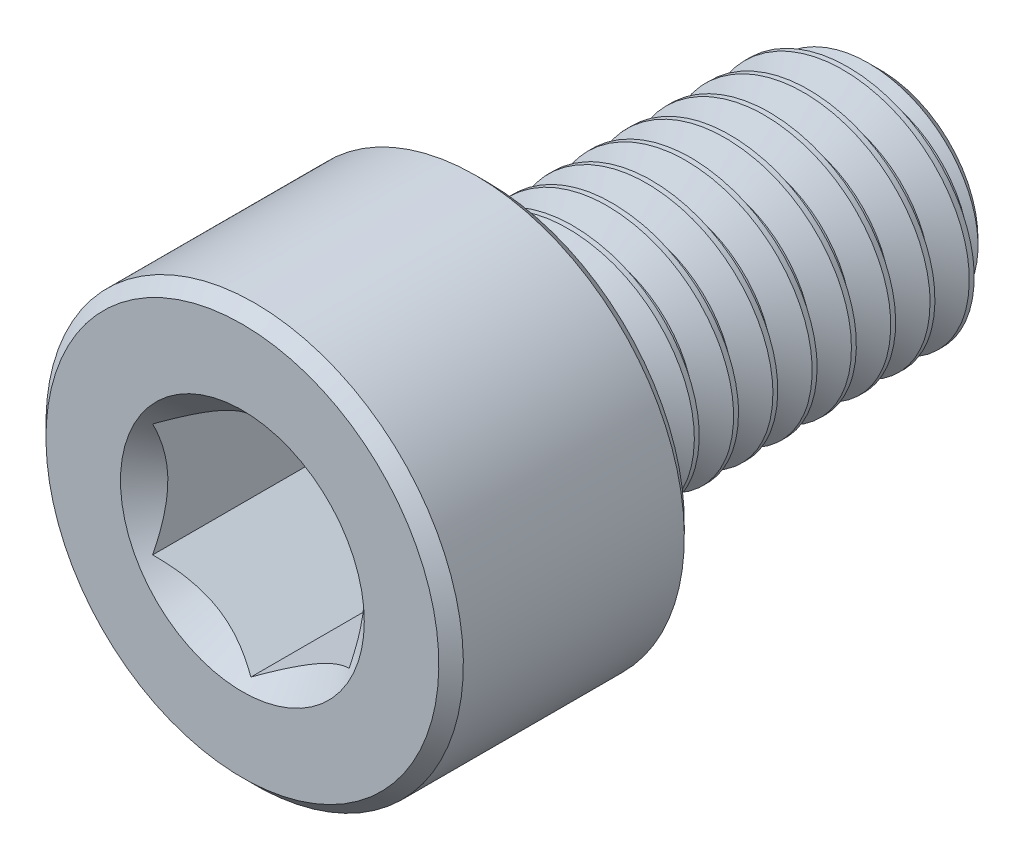
from build123d import *

# Parameters (mm, degrees)
CUT_EXTRUDE1_DEPTH     = 4
SPLIT1_SURFACE_1_BACK  = 18.706
SPLIT1_SURFACE_1_DEPTH = 37.412
SPLIT1_SURFACE_2_BACK  = 18.706
SPLIT1_SURFACE_2_DEPTH = 37.412
CUT_SWEEP1_PITCH       = 0.8
CUT_SWEEP1_TO          = 7.75


with BuildPart() as part:
    # Sketch2 → Revolve1 (revolve)
    with BuildSketch(Plane(origin=(0, 0, 0), x_dir=(0, 0, -1), z_dir=(1, 0, 0))):
        with BuildLine():
            Line((-6.5, 0), (-6.5, 4))
            Line((-6.5, 4), (-6.25, 4.25))
            Line((-6.25, 4.25), (-1.75, 4.25))
            Line((-1.75, 4.25), (-1.5, 4))
            Line((-1.5, 4), (-1.5, 2.75))
            ThreePointArc((-1.5, 2.75), (-1.426776695, 2.573223305), (-1.25, 2.5))
            Line((-1.25, 2.5), (5.980384758, 2.5))
            Line((5.980384758, 2.5), (6.5, 1.980384758))
            Line((6.5, 1.980384758), (6.5, 0))
            Line((6.5, 0), (-6.5, 0))
        make_face()
    revolve(axis=Axis((0, 0, -6.5), (0, 0, 1)))

    # Sketch3 → Cut-Extrude1 (cut)
    with BuildSketch(Plane.XY.offset(6.5)):
        Polygon((2, -1.154700538), (2, 1.154700538), (0, 2.309401077), (-2, 1.154700538), (-2, -1.154700538), (0, -2.309401077), align=None)
    extrude(amount=-CUT_EXTRUDE1_DEPTH, mode=Mode.SUBTRACT)

    # Cut-Extrude2 cone 1 section (through the dimple's axis) → Cut-Extrude2 (revolve, cut)
    with BuildSketch(Plane(origin=(0, 0, 6.5), x_dir=(0, -1, 0), z_dir=(1, 0, 0))):
        Polygon((0, 0), (2.482606158, 0), (0, 2.482606158), align=None)
    revolve(axis=Axis((0, 0, 6.5), (0, 0, -1)), mode=Mode.SUBTRACT)


with BuildPart() as body_2:
    # Split1: the piece behind the surface
    add(part.part)
    # Split1 surface: a surface, the sketch's curves swept straight by 37.412 mm
    with BuildLine(Plane(origin=(0, 0, 0), x_dir=(0, 0, -1), z_dir=(1, 0, 0)).offset(-SPLIT1_SURFACE_1_BACK), mode=Mode.PRIVATE) as split1_surface_1_path:
        Line((-1.25, -4.25), (-1.25, 4.25))
    split1_surface_1 = Shell.extrude(split1_surface_1_path.wire(), (1 * SPLIT1_SURFACE_1_DEPTH, 0 * SPLIT1_SURFACE_1_DEPTH, 0 * SPLIT1_SURFACE_1_DEPTH))
    split(bisect_by=split1_surface_1, keep=Keep.BOTTOM)

    # Cut-Sweep1: arcs per turn and ends read off the stored shape
    # Cut-Sweep1: the profile of Sketch7 screwed along a right-hand helix through 11 turns, 8 arcs to a turn; built about Z, then put on its axis
    cut_sweep1_z = Axis((0, 0, 0), (0, 0, 1))
    cut_sweep1_corners = [(2.54330127, 0, 0.025), (2.54330127, 0, -0.725), (1.980384758, 0, -0.4), (1.980384758, 0, -0.3)]
    with BuildLine(mode=Mode.PRIVATE) as cut_sweep1_profile:
        Line(cut_sweep1_corners[0], cut_sweep1_corners[1])
        Line(cut_sweep1_corners[1], cut_sweep1_corners[2])
        Line(cut_sweep1_corners[2], cut_sweep1_corners[3])
        Line(cut_sweep1_corners[3], cut_sweep1_corners[0])
    cut_sweep1_cap = Face(cut_sweep1_profile.wire())
    cut_sweep1_turn_angles = [0, 22.5, 45, 67.5, 90, 112.5, 135, 157.5, 180, 202.5, 225, 247.5, 270, 292.5, 315, 337.5, 360]
    cut_sweep1_turn_weights = [1, 0.9238795325112867, 1, 0.9238795325112867, 1, 0.9238795325112867, 1, 0.9238795325112867, 1, 0.9238795325112867, 1, 0.9238795325112867, 1, 0.9238795325112867, 1, 0.9238795325112867, 1]
    cut_sweep1_turn_rails = [Edge.make_bspline([Vector(p[0], p[1], 0).rotate(cut_sweep1_z, cut_sweep1_turn_angles[k]) / cut_sweep1_turn_weights[k] + Vector(0, 0, p[2] + CUT_SWEEP1_PITCH * cut_sweep1_turn_angles[k] / 360) for k in range(17)], [0, 0, 0, 1, 1, 2, 2, 3, 3, 4, 4, 5, 5, 6, 6, 7, 7, 8, 8, 8], 2, cut_sweep1_turn_weights) for p in cut_sweep1_corners]
    cut_sweep1_turn_sides = [Face.make_surface_from_curves(cut_sweep1_turn_rails[p[0]], cut_sweep1_turn_rails[p[1]]) for p in [(0, 1), (1, 2), (2, 3), (3, 0)]]
    cut_sweep1 = Plane(origin=(0, 0, -6.5), x_dir=(0, 1, 0), z_dir=(0, 0, 1)) * split(Solid(Shell([*[p.moved(Location((0, 0, CUT_SWEEP1_PITCH * i))) for i in range(11) for p in cut_sweep1_turn_sides], cut_sweep1_cap, cut_sweep1_cap.rotate(cut_sweep1_z, 3960).moved(Location((0, 0, CUT_SWEEP1_PITCH * 3960 / 360)))])), bisect_by=Plane.XY.offset(CUT_SWEEP1_TO), keep=Keep.BOTTOM, mode=Mode.PRIVATE)
    add(cut_sweep1, mode=Mode.SUBTRACT)


with BuildPart() as part_1:
    add(part.part)

    # Split1: split by a surface, the side it looks to stays
    # Split1 surface: a surface, the sketch's curves swept straight by 37.412 mm
    with BuildLine(Plane(origin=(0, 0, 0), x_dir=(0, 0, -1), z_dir=(1, 0, 0)).offset(-SPLIT1_SURFACE_2_BACK), mode=Mode.PRIVATE) as split1_surface_2_path:
        Line((-1.25, -4.25), (-1.25, 4.25))
    split1_surface_2 = Shell.extrude(split1_surface_2_path.wire(), (1 * SPLIT1_SURFACE_2_DEPTH, 0 * SPLIT1_SURFACE_2_DEPTH, 0 * SPLIT1_SURFACE_2_DEPTH))
    split(bisect_by=split1_surface_2, keep=Keep.TOP)

    add(body_2.part)  # Revolve2 merges body 2
    # Sketch8 → Revolve2 (revolve)
    with BuildSketch(Plane(origin=(0, 0, 0), x_dir=(0, 0, -1), z_dir=(1, 0, 0)), mode=Mode.PRIVATE) as revolve2_sk:
        Polygon((-1.5, 0), (-1.5, 2.5), (-1.25, 2.5), (0.193375673, 0), align=None)
    revolve(revolve2_sk.sketch.rotate(Axis((0, 0, -0.193375673), (0, 0, 1)), 270), axis=Axis((0, 0, -0.193375673), (0, 0, 1)))


solid = part_1.part
